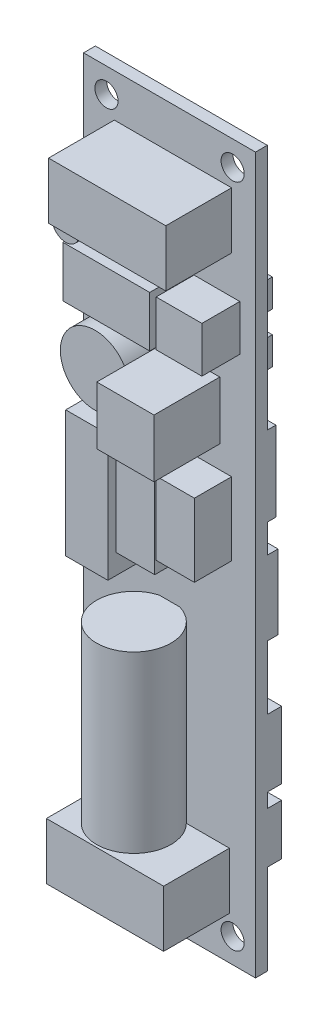
from build123d import *
from build123d.topology import SkipClean

# Parameters (mm, degrees)
SKETCH1_W            = 13.399995863
SKETCH1_H            = 3.049999941
BOSS_EXTRUDE1_DEPTH  = 2.449999563
SKETCH2_W            = 2.449999564
SKETCH2_H            = 2.249998972
BOSS_EXTRUDE2_DEPTH  = 3.100000322
SKETCH3_W            = 2.449999564
SKETCH3_H            = 3.350000014
BOSS_EXTRUDE3_DEPTH  = 42.550001293
SKETCH4_W            = 2.449999564
SKETCH4_H            = 0.499999966
CUT_EXTRUDE1_DEPTH   = 17.900001258
SKETCH5_W            = 2.449999564
SKETCH5_H            = 1.700000023
CUT_EXTRUDE2_DEPTH   = 9.549997747
BOSS_EXTRUDE4_DEPTH  = 3.049999475
BOSS_EXTRUDE5_DEPTH  = 0.100001693
BOSS_EXTRUDE6_DEPTH  = 2.499999478
BOSS_EXTRUDE7_DEPTH  = 2.100000158
BOSS_EXTRUDE8_DEPTH  = 3.500000574
BOSS_EXTRUDE9_DEPTH  = 7.399999653
SKETCH12_W           = 1.749999937
SKETCH12_H           = 0.600000029
CUT_EXTRUDE3_DEPTH   = 0.450000167
SKETCH13_W           = 1.749999937
SKETCH13_H           = 1.700000214
CUT_EXTRUDE4_DEPTH   = 10.750003159
SKETCH14_W           = 1.100001042
SKETCH14_H           = 3.899998963
CUT_EXTRUDE5_DEPTH   = 1.500000129
SKETCH15_W           = 4.599999636
SKETCH15_H           = 1.200000057
CUT_EXTRUDE6_DEPTH   = 5.599997938
SKETCH16_W           = 0.800000969
SKETCH16_H           = 3.250002861
CUT_EXTRUDE7_DEPTH   = 1.500000129
BOSS_EXTRUDE10_DEPTH = 1.049999963
SKETCH18_W           = 2.550000092
SKETCH18_H           = 0.599999172
CUT_EXTRUDE8_DEPTH   = 3.299996257
BOSS_EXTRUDE11_DEPTH = 0.199999995
BOSS_EXTRUDE12_DEPTH = 1.499999315
CUT_EXTRUDE9_DEPTH   = 2.350002527
BOSS_EXTRUDE13_DEPTH = 0.19999966
SKETCH23_W           = 24.049999527
SKETCH23_H           = 1.6499998
BOSS_EXTRUDE14_DEPTH = 32.499999143
SKETCH24_W           = 2.750000101
SKETCH24_H           = 10.499998927
CUT_EXTRUDE10_DEPTH  = 1.099999994
SKETCH25_W           = 4.649999552
SKETCH25_H           = 11.149998754
BOSS_EXTRUDE15_DEPTH = 1.30000012
SKETCH26_W           = 2.499999478
SKETCH26_H           = 8.89999792
BOSS_EXTRUDE16_DEPTH = 0.900000101
SKETCH27_W           = 24.049999527
SKETCH27_H           = 1.6499998
BOSS_EXTRUDE17_DEPTH = 8.500002325
SKETCH28_W           = 1.39999995
SKETCH28_H           = 9.4999969
CUT_EXTRUDE11_DEPTH  = 1.299999654
SKETCH29_W           = 1.399999979
SKETCH29_H           = 6.749995052
CUT_EXTRUDE12_DEPTH  = 4.399999845
SKETCH30_W           = 1.39999995
SKETCH30_H           = 2.999998629
CUT_EXTRUDE13_DEPTH  = 1.250000671
SKETCH31_W           = 15.400000382
SKETCH31_H           = 3.649994731
BOSS_EXTRUDE18_DEPTH = 1.000000164
SKETCH32_W           = 19.600000465
SKETCH32_H           = 3.899998963
BOSS_EXTRUDE19_DEPTH = 1.000000164
SKETCH33_W           = 19.600000465
SKETCH33_H           = 3.899998963
BOSS_EXTRUDE20_DEPTH = 0.700000091
SKETCH34_W           = 5.499999039
SKETCH34_H           = 1.200000057
CUT_EXTRUDE14_DEPTH  = 6.500001997
SKETCH35_W           = 1.200000057
SKETCH35_H           = 7.500000298
CUT_EXTRUDE15_DEPTH  = 3.999998793
SKETCH36_W           = 10.050000157
SKETCH36_H           = 0.699999975
BOSS_EXTRUDE21_DEPTH = 10.699998587
CUT_EXTRUDE16_REACH  = 103.633
SKETCH37_W           = 1.299999654
SKETCH37_H           = 1.099999994
SKETCH38_W           = 9.099999908
SKETCH38_H           = 6.999999285
BOSS_EXTRUDE22_DEPTH = 1.099999994
SKETCH39_W           = 0.699999975
SKETCH39_H           = 3.699999303
CUT_EXTRUDE17_DEPTH  = 6.650000345
SKETCH40_W           = 5.499999039
SKETCH40_H           = 0.500000082
CUT_EXTRUDE18_DEPTH  = 3.499999642
SKETCH41_W           = 0.599998981
SKETCH41_H           = 3.100000322
CUT_EXTRUDE19_DEPTH  = 18.450000556
CUT_EXTRUDE20_REACH  = 103.651
SKETCH43_W           = 1.39999995
SKETCH43_H           = 3.100000321
SKETCH44_W           = 1.200000057
SKETCH44_H           = 6.900005043
CUT_EXTRUDE21_DEPTH  = 1.149998978
CUT_EXTRUDE22_REACH  = 66.657
SKETCH45_W           = 0.950000249
SKETCH45_H           = 0.699999975
SKETCH46_W           = 2.499999479
SKETCH46_H           = 11.149998754
BOSS_EXTRUDE23_DEPTH = 2.400000114
SKETCH47_W           = 9.399999864
SKETCH47_H           = 9.399998933
BOSS_EXTRUDE24_DEPTH = 2.000000286
SKETCH48_W           = 8.199999109
SKETCH48_H           = 7.100000046
BOSS_EXTRUDE25_DEPTH = 2.000000095
SKETCH49_W           = 15.400000382
SKETCH49_H           = 3.650000319
BOSS_EXTRUDE26_DEPTH = 2.400000114
RIB1_START           = -3.949999809
RIB1_DEPTH           = 7.899999618
RIB2_START           = -3.700000234
RIB2_OUTLINE_W       = 8.600000292
RIB2_OUTLINE_H       = 1.39999995
RIB2_DEPTH           = 7.400000468
RIB3_START           = -1.550000161
RIB3_OUTLINE_W       = 8.300000336
RIB3_OUTLINE_H       = 1.59999996
RIB3_DEPTH           = 3.100000322
SKETCH116_W          = 8.00000038
SKETCH116_H          = 8.100003004
BOSS_EXTRUDE27_DEPTH = 9.200000204
SKETCH166_W          = 16.400000546
SKETCH166_H          = 7.899999619
BOSS_EXTRUDE31_DEPTH = 9.200000204
SKETCH167_W          = 12.149999617
SKETCH167_H          = 7.099993527
BOSS_EXTRUDE32_DEPTH = 4.900000058
SKETCH168_W          = 6.399999373
SKETCH168_H          = 6.400004029
BOSS_EXTRUDE33_DEPTH = 5.299999844
SKETCH169_W          = 5.40000014
SKETCH169_H          = 12.400001288
BOSS_EXTRUDE34_DEPTH = 5.200000014
SKETCH170_W          = 5.40000014
SKETCH170_H          = 10.2000013
BOSS_EXTRUDE35_DEPTH = 5.200000014
SKETCH171_W          = 5.900000455
SKETCH171_H          = 17.700001597
BOSS_EXTRUDE36_DEPTH = 5.900000222
SKETCH172_W          = 16.399999149
SKETCH172_H          = 7.900000084
BOSS_EXTRUDE37_DEPTH = 9.200000204
SKETCH173_R          = 1.6188123
CUT_EXTRUDE28_DEPTH  = 1.649999991
SKETCH175_R          = 1.90001443
BOSS_EXTRUDE39_DEPTH = 5.7000001
SKETCH177_R          = 5.199981619
BOSS_EXTRUDE40_DEPTH = 24.39999953
SKETCH178_R          = 4.850000143
BOSS_EXTRUDE41_DEPTH = 4.80000023


# Read off the part's stored shape, not the designer's step: Rib1, Rib2, Rib3
with BuildPart() as part:
    # Sketch1 → Boss-Extrude1 (new body)
    with BuildSketch(Plane(origin=(11.950000189, 0, 0), x_dir=(0, -1, 0), z_dir=(-1, 0, 0))):
        with Locations((-84.649998694, 0.125000021)):
            Rectangle(SKETCH1_W, SKETCH1_H)
    extrude(amount=-BOSS_EXTRUDE1_DEPTH)

    # Sketch2 → Boss-Extrude2 (add)
    with BuildSketch(Plane.XZ.offset(-77.950000763)):
        with Locations((13.174999971, 0.525000505)):
            Rectangle(SKETCH2_W, SKETCH2_H)
    extrude(amount=BOSS_EXTRUDE2_DEPTH)

    # Sketch3 → Boss-Extrude3 (add)
    with BuildSketch(Plane.XZ.offset(-74.850000441)):
        with Locations((13.174999971, -0.025000016)):
            Rectangle(SKETCH3_W, SKETCH3_H)
    extrude(amount=BOSS_EXTRUDE3_DEPTH)

    # Sketch4 → Cut-Extrude1 (cut)
    with BuildSketch(Plane.XZ.offset(-32.299999148)):
        with Locations((13.174999971, -1.45000004)):
            Rectangle(SKETCH4_W, SKETCH4_H)
    extrude(amount=-CUT_EXTRUDE1_DEPTH, mode=Mode.SUBTRACT)

    # Sketch5 → Cut-Extrude2 (cut)
    with BuildSketch(Plane.XZ.offset(-50.200000405)):
        with Locations((13.174999971, -0.850000012)):
            Rectangle(SKETCH5_W, SKETCH5_H)
    extrude(amount=-CUT_EXTRUDE2_DEPTH, mode=Mode.SUBTRACT)

    # Sketch6 → Boss-Extrude4 (add)
    with BuildSketch(Plane(origin=(14.399999753, 0, 0), x_dir=(0, 0, -1), z_dir=(1, 0, 0))):
        Polygon((1.200000057, 50.200000405), (1.200000057, 32.299999148), (-1.649999991, 32.299999148), (-1.649999991, 91.349996626), (1.39999995, 91.349996626), (1.39999995, 77.950000763), (0.599998981, 77.950000763), (0.599998981, 74.850000441), (1.700000023, 74.850000441), (1.700000023, 70.950001478), (0, 70.950001478), (0, 50.200000405), align=None)
    extrude(amount=BOSS_EXTRUDE4_DEPTH)

    # Sketch7 → Boss-Extrude5 (add)
    with BuildSketch(Plane(origin=(17.449999228, 0, 0), x_dir=(0, 0, -1), z_dir=(1, 0, 0))):
        Polygon((1.700000023, 70.950001478), (0, 70.950001478), (0, 50.200000405), (1.500000013, 50.200000405), (1.500000013, 39.799999446), (1.200000057, 39.799999446), (1.200000057, 32.299999148), (-1.649999991, 32.299999148), (-1.649999991, 91.349996626), (1.39999995, 91.349996626), (1.39999995, 77.950000763), (0.599998981, 77.950000763), (0.599998981, 74.850000441), (1.700000023, 74.850000441), align=None)
    extrude(amount=BOSS_EXTRUDE5_DEPTH)

    # Sketch8 → Boss-Extrude6 (add)
    with BuildSketch(Plane(origin=(17.550000921, 0, 0), x_dir=(0, 0, -1), z_dir=(1, 0, 0))):
        Polygon((1.500000013, 39.799999446), (1.200000057, 39.799999446), (1.200000057, 32.299999148), (-1.649999991, 32.299999148), (-1.649999991, 91.349996626), (1.39999995, 91.349996626), (1.39999995, 77.950000763), (0.599998981, 77.950000763), (0.599998981, 74.850000441), (1.700000023, 74.850000441), (1.700000023, 70.950001478), (1.200000057, 70.950001478), (1.200000057, 58.449998498), (1.500000013, 58.449998498), align=None)
    extrude(amount=BOSS_EXTRUDE6_DEPTH)

    # Sketch9 → Boss-Extrude7 (add)
    with BuildSketch(Plane(origin=(20.050000399, 0, 0), x_dir=(0, 0, -1), z_dir=(1, 0, 0))):
        Polygon((1.200000057, 70.950001478), (1.200000057, 54.200001061), (-1.91e-07, 54.200001061), (-1.91e-07, 50.200000405), (1.500000013, 50.200000405), (1.500000013, 39.799999446), (1.200000057, 39.799999446), (1.200000057, 32.299999148), (-1.649999991, 32.299999148), (-1.649999991, 91.349996626), (1.39999995, 91.349996626), (1.39999995, 77.950000763), (0.599998981, 77.950000763), (0.599998981, 74.850000441), (1.700000023, 74.850000441), (1.700000023, 70.950001478), align=None)
    extrude(amount=BOSS_EXTRUDE7_DEPTH)

    # Sketch10 → Boss-Extrude8 (add)
    with SkipClean():  # the faces are left unmerged after this step: merging them gives an invalid solid
        with BuildSketch(Plane.ZY.offset(-11.950000189)):
            Polygon((0, 32.299999148), (0, 59.749998152), (-1.700000023, 59.749998152), (-1.700000023, 74.850000441), (-0.599998981, 74.850000441), (-0.599998981, 77.950000763), (-1.39999995, 77.950000763), (-1.39999995, 91.349996626), (1.6499998, 91.349996626), (1.6499998, 32.299999148), align=None)
        extrude(amount=BOSS_EXTRUDE8_DEPTH)

    # Sketch11 → Boss-Extrude9 (add)
    with SkipClean():  # the faces are left unmerged after this step: merging them gives an invalid solid
        with BuildSketch(Plane.ZY.offset(-8.449999616)):
            Polygon((-1.099999994, 59.749998152), (-1.700000023, 59.749998152), (-1.700000023, 74.850000441), (-0.599998981, 74.850000441), (-0.599998981, 77.950000763), (-1.39999995, 77.950000763), (-1.39999995, 91.349996626), (1.649999991, 91.349996626), (1.649999991, 32.299999148), (1.91e-07, 32.299999148), (1.91e-07, 47.299999744), (-1.099999994, 47.299999744), align=None)
        extrude(amount=BOSS_EXTRUDE9_DEPTH)

    # Sketch12 → Cut-Extrude3 (cut)
    with SkipClean():  # the faces are left unmerged after this step: merging them gives an invalid solid
        with BuildSketch(Plane.XZ.offset(-59.749998152)):
            with Locations((1.924999931, -1.400000009)):
                Rectangle(SKETCH12_W, SKETCH12_H)
        extrude(amount=-CUT_EXTRUDE3_DEPTH, mode=Mode.SUBTRACT)

    # Sketch13 → Cut-Extrude4 (cut)
    with SkipClean():  # the faces are left unmerged after this step: merging them gives an invalid solid
        with BuildSketch(Plane.XZ.offset(-60.199998319)):
            with Locations((1.924999931, -0.849999916)):
                Rectangle(SKETCH13_W, SKETCH13_H)
        extrude(amount=-CUT_EXTRUDE4_DEPTH, mode=Mode.SUBTRACT)

    # Sketch14 → Cut-Extrude5 (cut)
    with SkipClean():  # the faces are left unmerged after this step: merging them gives an invalid solid
        with BuildSketch(Plane.ZY.offset(-1.049999963)):
            with Locations((-1.149999502, 72.90000096)):
                Rectangle(SKETCH14_W, SKETCH14_H)
        extrude(amount=-CUT_EXTRUDE5_DEPTH, mode=Mode.SUBTRACT)

    # Sketch15 → Cut-Extrude6 (cut)
    with SkipClean():  # the faces are left unmerged after this step: merging them gives an invalid solid
        with BuildSketch(Plane(origin=(0, 70.950001478, 0), x_dir=(1, 0, 0), z_dir=(0, 1, 0))):
            with Locations((19.850000739, 0.600000029)):
                Rectangle(SKETCH15_W, SKETCH15_H)
        extrude(amount=-CUT_EXTRUDE6_DEPTH, mode=Mode.SUBTRACT)

    # Sketch16 → Cut-Extrude7 (cut)
    with SkipClean():  # the faces are left unmerged after this step: merging them gives an invalid solid
        with BuildSketch(Plane.ZY.offset(-1.049999963)):
            with Locations((-0.999999465, 79.575002194)):
                Rectangle(SKETCH16_W, SKETCH16_H)
        extrude(amount=-CUT_EXTRUDE7_DEPTH, mode=Mode.SUBTRACT)

    # Sketch17 → Boss-Extrude10 (add)
    with BuildSketch(Plane.ZY.offset(-1.049999963)):
        Polygon((1.91e-07, 70.950001478), (-0.599998981, 70.950001478), (-0.599998981, 81.200003624), (-1.39999995, 81.200003624), (-1.39999995, 91.349996626), (1.649999991, 91.349996626), (1.649999991, 32.299999148), (1.91e-07, 32.299999148), align=None)
    extrude(amount=BOSS_EXTRUDE10_DEPTH)

    # Sketch18 → Cut-Extrude8 (cut)
    with BuildSketch(Plane.XZ.offset(-70.950001478)):
        with Locations((1.275000046, -0.299999395)):
            Rectangle(SKETCH18_W, SKETCH18_H)
    extrude(amount=-CUT_EXTRUDE8_DEPTH, mode=Mode.SUBTRACT)

    # Sketch19 → Boss-Extrude11 (add)
    with BuildSketch(Plane.ZY):
        Polygon((-0.599998981, 81.200003624), (-1.39999995, 81.200003624), (-1.39999995, 91.349996626), (1.649999991, 91.349996626), (1.649999991, 32.299999148), (1.91e-07, 32.299999148), (1.91e-07, 74.249997735), (-0.599998981, 74.249997735), align=None)
    extrude(amount=BOSS_EXTRUDE11_DEPTH)

    # Sketch20 → Boss-Extrude12 (add)
    with BuildSketch(Plane(origin=(22.150000557, 0, 0), x_dir=(0, 0, -1), z_dir=(1, 0, 0))):
        Polygon((-1.649999991, 32.299999148), (-1.649999991, 91.349996626), (-1.91e-07, 91.349996626), (-1.91e-07, 65.350003541), (1.200000057, 65.350003541), (1.200000057, 54.200001061), (-1.91e-07, 54.200001061), (-1.91e-07, 50.200000405), (1.500000013, 50.200000405), (1.500000013, 39.799999446), (1.200000057, 39.799999446), (1.200000057, 32.299999148), align=None)
    extrude(amount=BOSS_EXTRUDE12_DEPTH)

    # Sketch21 → Cut-Extrude9 (cut)
    with BuildSketch(Plane(origin=(0, 81.200003624, 0), x_dir=(1, 0, 0), z_dir=(0, 1, 0))):
        Polygon((-0.199999995, -1.91e-07), (0, -1.91e-07), (2.550000092, -1.91e-07), (2.550000092, 0.599998981), (-0.199999995, 0.599998981), align=None)
    extrude(amount=-CUT_EXTRUDE9_DEPTH, mode=Mode.SUBTRACT)

    # Sketch22 → Boss-Extrude13 (add)
    with BuildSketch(Plane(origin=(23.649999872, 0, 0), x_dir=(0, 0, -1), z_dir=(1, 0, 0))):
        Polygon((-1.649999991, 32.299999148), (-1.649999991, 91.349996626), (-1.91e-07, 91.349996626), (-1.91e-07, 65.350003541), (1.200000057, 65.350003541), (1.200000057, 54.200001061), (-1.91e-07, 54.200001061), (-1.91e-07, 50.200000405), (1.500000013, 50.200000405), (1.500000013, 39.799999446), (1.200000057, 39.799999446), (1.200000057, 32.299999148), align=None)
    extrude(amount=BOSS_EXTRUDE13_DEPTH)

    # Sketch23 → Boss-Extrude14 (add)
    with BuildSketch(Plane.XZ.offset(-32.299999148)):
        with Locations((11.824999769, 0.825000091)):
            Rectangle(SKETCH23_W, SKETCH23_H)
    extrude(amount=BOSS_EXTRUDE14_DEPTH)

    # Sketch24 → Cut-Extrude10 (cut)
    with SkipClean():  # the faces are left unmerged after this step: merging them gives an invalid solid
        with BuildSketch(Plane(origin=(0, 0, -1.099999994), x_dir=(-1, 0, 0), z_dir=(0, 0, -1))):
            with Locations((-2.425000014, 52.549999208)):
                Rectangle(SKETCH24_W, SKETCH24_H)
        extrude(amount=-CUT_EXTRUDE10_DEPTH, mode=Mode.SUBTRACT)

    # Sketch25 → Boss-Extrude15 (add)
    with SkipClean():  # the faces are left unmerged after this step: merging them gives an invalid solid
        with BuildSketch(Plane(origin=(0, 0, -1.099999994), x_dir=(-1, 0, 0), z_dir=(0, 0, -1))):
            with Locations((-6.12499984, 52.874999121)):
                Rectangle(SKETCH25_W, SKETCH25_H)
        extrude(amount=BOSS_EXTRUDE15_DEPTH)

    # Sketch26 → Boss-Extrude16 (add)
    with SkipClean():  # the faces are left unmerged after this step: merging them gives an invalid solid
        with BuildSketch(Plane(origin=(0, 0, -1.500000013), x_dir=(-1, 0, 0), z_dir=(0, 0, -1))):
            with Locations((-18.80000066, 53.999999538)):
                Rectangle(SKETCH26_W, SKETCH26_H)
        extrude(amount=BOSS_EXTRUDE16_DEPTH)

    # Sketch27 → Boss-Extrude17 (add)
    with SkipClean():  # the faces are left unmerged after this step: merging them gives an invalid solid
        with BuildSketch(Plane(origin=(0, 91.349996626, 0), x_dir=(-1, 0, 0), z_dir=(0, 1, 0))):
            with Locations((-11.824999769, 0.825000091)):
                Rectangle(SKETCH27_W, SKETCH27_H)
        extrude(amount=BOSS_EXTRUDE17_DEPTH)

    # Sketch28 → Cut-Extrude11 (cut)
    with SkipClean():  # the faces are left unmerged after this step: merging them gives an invalid solid
        with BuildSketch(Plane(origin=(22.150000557, 0, 0), x_dir=(0, 0, -1), z_dir=(1, 0, 0))):
            with Locations((0.699999975, 86.599998176)):
                Rectangle(SKETCH28_W, SKETCH28_H)
        extrude(amount=-CUT_EXTRUDE11_DEPTH, mode=Mode.SUBTRACT)

    # Sketch29 → Cut-Extrude12 (cut)
    with SkipClean():  # the faces are left unmerged after this step: merging them gives an invalid solid
        with BuildSketch(Plane.ZY.offset(0.199999995)):
            with Locations((-0.699999961, 87.9749991)):
                Rectangle(SKETCH29_W, SKETCH29_H)
        extrude(amount=-CUT_EXTRUDE12_DEPTH, mode=Mode.SUBTRACT)

    # Sketch30 → Cut-Extrude13 (cut)
    with SkipClean():  # the faces are left unmerged after this step: merging them gives an invalid solid
        with BuildSketch(Plane(origin=(20.850000903, 0, 0), x_dir=(0, 0, -1), z_dir=(1, 0, 0))):
            with Locations((0.699999975, 89.849997312)):
                Rectangle(SKETCH30_W, SKETCH30_H)
        extrude(amount=-CUT_EXTRUDE13_DEPTH, mode=Mode.SUBTRACT)

    # Sketch31 → Boss-Extrude18 (add)
    with SkipClean():  # the faces are left unmerged after this step: merging them gives an invalid solid
        with BuildSketch(Plane(origin=(0, 0, -1.39999995), x_dir=(-1, 0, 0), z_dir=(0, 0, -1))):
            with Locations((-11.900000041, 89.524999261)):
                Rectangle(SKETCH31_W, SKETCH31_H)
        extrude(amount=BOSS_EXTRUDE18_DEPTH)

    # Sketch32 → Boss-Extrude19 (add)
    with SkipClean():  # the faces are left unmerged after this step: merging them gives an invalid solid
        with BuildSketch(Plane(origin=(0, 0, -1.39999995), x_dir=(-1, 0, 0), z_dir=(0, 0, -1))):
            with Locations((-12.350000325, 79.900000245)):
                Rectangle(SKETCH32_W, SKETCH32_H)
        extrude(amount=BOSS_EXTRUDE19_DEPTH)

    # Sketch33 → Boss-Extrude20 (add)
    with SkipClean():  # the faces are left unmerged after this step: merging them gives an invalid solid
        with BuildSketch(Plane(origin=(0, 0, -1.700000023), x_dir=(-1, 0, 0), z_dir=(0, 0, -1))):
            with Locations((-12.350000325, 72.90000096)):
                Rectangle(SKETCH33_W, SKETCH33_H)
        extrude(amount=BOSS_EXTRUDE20_DEPTH)

    # Sketch34 → Cut-Extrude14 (cut)
    with SkipClean():  # the faces are left unmerged after this step: merging them gives an invalid solid
        with BuildSketch(Plane(origin=(0, 50.200000405, 0), x_dir=(-1, 0, 0), z_dir=(0, 1, 0))):
            with Locations((-14.699999709, -0.600000029)):
                Rectangle(SKETCH34_W, SKETCH34_H)
        extrude(amount=-CUT_EXTRUDE14_DEPTH, mode=Mode.SUBTRACT)

    # Sketch35 → Cut-Extrude15 (cut)
    with SkipClean():  # the faces are left unmerged after this step: merging them gives an invalid solid
        with BuildSketch(Plane(origin=(23.849999532, 0, 0), x_dir=(0, 0, -1), z_dir=(1, 0, 0))):
            with Locations((0.600000029, 36.049999297)):
                Rectangle(SKETCH35_W, SKETCH35_H)
        extrude(amount=-CUT_EXTRUDE15_DEPTH, mode=Mode.SUBTRACT)

    # Sketch36 → Boss-Extrude21 (add)
    with SkipClean():  # the faces are left unmerged after this step: merging them gives an invalid solid
        with BuildSketch(Plane(origin=(0, 43.699998409, 0), x_dir=(1, 0, 0), z_dir=(0, 1, 0))):
            with Locations((6.925000111, 0.349999987)):
                Rectangle(SKETCH36_W, SKETCH36_H)
        extrude(amount=-BOSS_EXTRUDE21_DEPTH)

    # Sketch37 → Cut-Extrude16 (cut, up to next)
    with BuildSketch(Plane(origin=(5.049999803, 0, 0), x_dir=(0, -1, 0), z_dir=(-1, 0, 0)), mode=Mode.PRIVATE) as cut_extrude16_sk1:
        with Locations((-59.099998325, -0.549999997)):
            Rectangle(SKETCH37_W, SKETCH37_H)
    cut_extrude16_tool1 = extrude(cut_extrude16_sk1.sketch, amount=-CUT_EXTRUDE16_REACH, mode=Mode.PRIVATE) & part.part
    add(cut_extrude16_tool1.solids().sort_by_distance((5.05, 59.099998, -0.55))[0], mode=Mode.SUBTRACT)

    # Sketch38 → Boss-Extrude22 (add)
    with SkipClean():  # the faces are left unmerged after this step: merging them gives an invalid solid
        with BuildSketch(Plane(origin=(0, 0, -0.699999975), x_dir=(-1, 0, 0), z_dir=(0, 0, -1))):
            with Locations((-6.449999986, 36.499999464)):
                Rectangle(SKETCH38_W, SKETCH38_H)
        extrude(amount=BOSS_EXTRUDE22_DEPTH)

    # Sketch39 → Cut-Extrude17 (cut)
    with SkipClean():  # the faces are left unmerged after this step: merging them gives an invalid solid
        with BuildSketch(Plane.ZY.offset(-1.900000032)):
            with Locations((-0.349999987, 41.849998758)):
                Rectangle(SKETCH39_W, SKETCH39_H)
        extrude(amount=-CUT_EXTRUDE17_DEPTH, mode=Mode.SUBTRACT)

    # Sketch40 → Cut-Extrude18 (cut)
    with SkipClean():  # the faces are left unmerged after this step: merging them gives an invalid solid
        with BuildSketch(Plane(origin=(0, 43.699998409, 0), x_dir=(-1, 0, 0), z_dir=(0, 1, 0))):
            with Locations((-14.699999709, -0.950000016)):
                Rectangle(SKETCH40_W, SKETCH40_H)
        extrude(amount=-CUT_EXTRUDE18_DEPTH, mode=Mode.SUBTRACT)

    # Sketch41 → Cut-Extrude19 (cut)
    with SkipClean():  # the faces are left unmerged after this step: merging them gives an invalid solid
        with BuildSketch(Plane(origin=(22.150000557, 0, 0), x_dir=(0, 0, -1), z_dir=(1, 0, 0))):
            with Locations((0.299999491, 76.400000602)):
                Rectangle(SKETCH41_W, SKETCH41_H)
        extrude(amount=-CUT_EXTRUDE19_DEPTH, mode=Mode.SUBTRACT)

    # Sketch43 → Cut-Extrude20 (cut, up to next)
    with BuildSketch(Plane(origin=(4.949999973, 0, 0), x_dir=(0, 0, -1), z_dir=(1, 0, 0)), mode=Mode.PRIVATE) as cut_extrude20_sk1:
        with Locations((0.699999975, 86.150001734)):
            Rectangle(SKETCH43_W, SKETCH43_H)
    cut_extrude20_tool1 = extrude(cut_extrude20_sk1.sketch, amount=-CUT_EXTRUDE20_REACH, mode=Mode.PRIVATE) & part.part
    add(cut_extrude20_tool1.solids().sort_by_distance((4.95, 86.150002, -0.7))[0], mode=Mode.SUBTRACT)

    # Sketch44 → Cut-Extrude21 (cut)
    with SkipClean():  # the faces are left unmerged after this step: merging them gives an invalid solid
        with BuildSketch(Plane.ZY.offset(-17.550000921)):
            with Locations((-0.600000029, 61.90000102)):
                Rectangle(SKETCH44_W, SKETCH44_H)
        extrude(amount=-CUT_EXTRUDE21_DEPTH, mode=Mode.SUBTRACT)

    # Sketch45 → Cut-Extrude22 (cut, up to next)
    with BuildSketch(Plane(origin=(0, 39.799999446, 0), x_dir=(1, 0, 0), z_dir=(0, 1, 0)), mode=Mode.PRIVATE) as cut_extrude22_sk1:
        with Locations((11.475000065, 0.349999987)):
            Rectangle(SKETCH45_W, SKETCH45_H)
    cut_extrude22_tool1 = extrude(cut_extrude22_sk1.sketch, amount=-CUT_EXTRUDE22_REACH, mode=Mode.PRIVATE) & part.part
    add(cut_extrude22_tool1.solids().sort_by_distance((11.475, 39.799999, -0.35))[0], mode=Mode.SUBTRACT)

    # Sketch46 → Boss-Extrude23 (add)
    with SkipClean():  # the faces are left unmerged after this step: merging them gives an invalid solid
        with BuildSketch(Plane(origin=(0, 0, 0), x_dir=(-1, 0, 0), z_dir=(0, 0, -1))):
            with Locations((-12.14999985, 52.874999121)):
                Rectangle(SKETCH46_W, SKETCH46_H)
        extrude(amount=BOSS_EXTRUDE23_DEPTH)

    # Sketch47 → Boss-Extrude24 (add)
    with SkipClean():  # the faces are left unmerged after this step: merging them gives an invalid solid
        with BuildSketch(Plane(origin=(0, 0, 0), x_dir=(-1, 0, 0), z_dir=(0, 0, -1))):
            with Locations((-19.1499996, 26.200000196)):
                Rectangle(SKETCH47_W, SKETCH47_H)
        extrude(amount=BOSS_EXTRUDE24_DEPTH)

    # Sketch48 → Boss-Extrude25 (add)
    with SkipClean():  # the faces are left unmerged after this step: merging them gives an invalid solid
        with BuildSketch(Plane(origin=(0, 0, 0), x_dir=(-1, 0, 0), z_dir=(0, 0, -1))):
            with Locations((-19.749999978, 15.950000379)):
                Rectangle(SKETCH48_W, SKETCH48_H)
        extrude(amount=BOSS_EXTRUDE25_DEPTH)

    # Sketch49 → Boss-Extrude26 (add)
    with SkipClean():  # the faces are left unmerged after this step: merging them gives an invalid solid
        with BuildSketch(Plane(origin=(0, 0, 0), x_dir=(-1, 0, 0), z_dir=(0, 0, -1))):
            with Locations((-11.700000381, 10.0250002)):
                Rectangle(SKETCH49_W, SKETCH49_H)
        extrude(amount=BOSS_EXTRUDE26_DEPTH)

    # Rib1 outline → Rib1 (add)
    with SkipClean():  # the faces are left unmerged after this step: merging them gives an invalid solid
        with BuildSketch(Plane.XZ.offset(-65.650001168).offset(RIB1_START)):
            Polygon((13.70000001, -1.700000023), (13.70000001, -2.400000114), (17.349999398, -2.400000114), (17.349999398, 0), (14.399999753, 0), (14.399999753, -1.700000023), align=None)
        extrude(amount=RIB1_DEPTH)

    # Rib2 outline → Rib2 (add)
    with SkipClean():  # the faces are left unmerged after this step: merging them gives an invalid solid
        with BuildSketch(Plane(origin=(5.900000222, 0, 0), x_dir=(0, -1, 0), z_dir=(-1, 0, 0)).offset(RIB2_START)):
            with Locations((-28.699999675, -0.699999975)):
                Rectangle(RIB2_OUTLINE_W, RIB2_OUTLINE_H)
        extrude(amount=RIB2_DEPTH)

    # Rib3 outline → Rib3 (add)
    with SkipClean():  # the faces are left unmerged after this step: merging them gives an invalid solid
        with BuildSketch(Plane.XZ.offset(-15.949999914).offset(RIB3_START)):
            with Locations((11.500000255, -0.79999998)):
                Rectangle(RIB3_OUTLINE_W, RIB3_OUTLINE_H)
        extrude(amount=RIB3_DEPTH)

    # Sketch116 → Boss-Extrude27 (add)
    with SkipClean():  # the faces are left unmerged after this step: merging them gives an invalid solid
        with BuildSketch(Plane.XY.offset(1.649999991)):
            with Locations((14.850000385, 66.050000489)):
                Rectangle(SKETCH116_W, SKETCH116_H)
        extrude(amount=BOSS_EXTRUDE27_DEPTH)

    # Sketch166 → Boss-Extrude31 (add)
    with SkipClean():  # the faces are left unmerged after this step: merging them gives an invalid solid
        with BuildSketch(Plane.XY.offset(1.649999991)):
            with Locations((12.300000293, 89.900001884)):
                Rectangle(SKETCH166_W, SKETCH166_H)
        extrude(amount=BOSS_EXTRUDE31_DEPTH)

    # Sketch167 → Boss-Extrude32 (add)
    with SkipClean():  # the faces are left unmerged after this step: merging them gives an invalid solid
        with BuildSketch(Plane.XY.offset(1.649999991)):
            with Locations((7.874999778, 76.799999923)):
                Rectangle(SKETCH167_W, SKETCH167_H)
        extrude(amount=BOSS_EXTRUDE32_DEPTH)

    # Sketch168 → Boss-Extrude33 (add)
    with SkipClean():  # the faces are left unmerged after this step: merging them gives an invalid solid
        with BuildSketch(Plane.XY.offset(1.649999991)):
            with Locations((18.449999857, 77.44999975)):
                Rectangle(SKETCH168_W, SKETCH168_H)
        extrude(amount=BOSS_EXTRUDE33_DEPTH)

    # Sketch169 → Boss-Extrude34 (add)
    with SkipClean():  # the faces are left unmerged after this step: merging them gives an invalid solid
        with BuildSketch(Plane.XY.offset(1.649999991)):
            with Locations((12.24999968, 52.999999374)):
                Rectangle(SKETCH169_W, SKETCH169_H)
        extrude(amount=BOSS_EXTRUDE34_DEPTH)

    # Sketch170 → Boss-Extrude35 (add)
    with SkipClean():  # the faces are left unmerged after this step: merging them gives an invalid solid
        with BuildSketch(Plane.XY.offset(1.649999991)):
            with Locations((17.800000496, 53.750000894)):
                Rectangle(SKETCH170_W, SKETCH170_H)
        extrude(amount=BOSS_EXTRUDE35_DEPTH)

    # Sketch171 → Boss-Extrude36 (add)
    with SkipClean():  # the faces are left unmerged after this step: merging them gives an invalid solid
        with BuildSketch(Plane.XY.offset(1.649999991)):
            with Locations((6.150000147, 52.400000394)):
                Rectangle(SKETCH171_W, SKETCH171_H)
        extrude(amount=BOSS_EXTRUDE36_DEPTH)

    # Sketch172 → Boss-Extrude37 (add)
    with SkipClean():  # the faces are left unmerged after this step: merging them gives an invalid solid
        with BuildSketch(Plane.XY.offset(1.649999991)):
            with Locations((11.999999639, 9.749999968)):
                Rectangle(SKETCH172_W, SKETCH172_H)
        extrude(amount=BOSS_EXTRUDE37_DEPTH)

    # Sketch173 → Cut-Extrude28 (cut)
    with SkipClean():  # the faces are left unmerged after this step: merging them gives an invalid solid
        with BuildSketch(Plane.XY.offset(1.649999991)):
            with Locations((3.000001529, 96.399998889)):
                Circle(SKETCH173_R)
            with Locations((20.649998008, 96.399998889)):
                Circle(SKETCH173_R)
            with Locations((3.000001529, 3.250000067)):
                Circle(SKETCH173_R)
            with Locations((20.649998008, 3.250000067)):
                Circle(SKETCH173_R)
        extrude(amount=-CUT_EXTRUDE28_DEPTH, mode=Mode.SUBTRACT)

    # Sketch175 → Boss-Extrude39 (add)
    with SkipClean():  # the faces are left unmerged after this step: merging them gives an invalid solid
        with BuildSketch(Plane.XY.offset(1.649999991)):
            with Locations(Location((2.999929427, 83.24994224, 0), (0, 0, 180))):
                Circle(SKETCH175_R)
        extrude(amount=BOSS_EXTRUDE39_DEPTH)

    # Sketch177 → Boss-Extrude40 (add)
    with SkipClean():  # the faces are left unmerged after this step: merging them gives an invalid solid
        with BuildSketch(Plane(origin=(0, 39.449998951, 0), x_dir=(1, 0, 0), z_dir=(0, 1, 0))):
            with Locations((11.824977568, -6.649977497)):
                Circle(SKETCH177_R)
        extrude(amount=-BOSS_EXTRUDE40_DEPTH)

    # Sketch178 → Boss-Extrude41 (add)
    with SkipClean():  # the faces are left unmerged after this step: merging them gives an invalid solid
        with BuildSketch(Plane.XY.offset(6.450000221)):
            with Locations((6.199980306, 67.000001669)):
                Circle(SKETCH178_R)
        extrude(amount=-BOSS_EXTRUDE41_DEPTH)


solid = part.part
